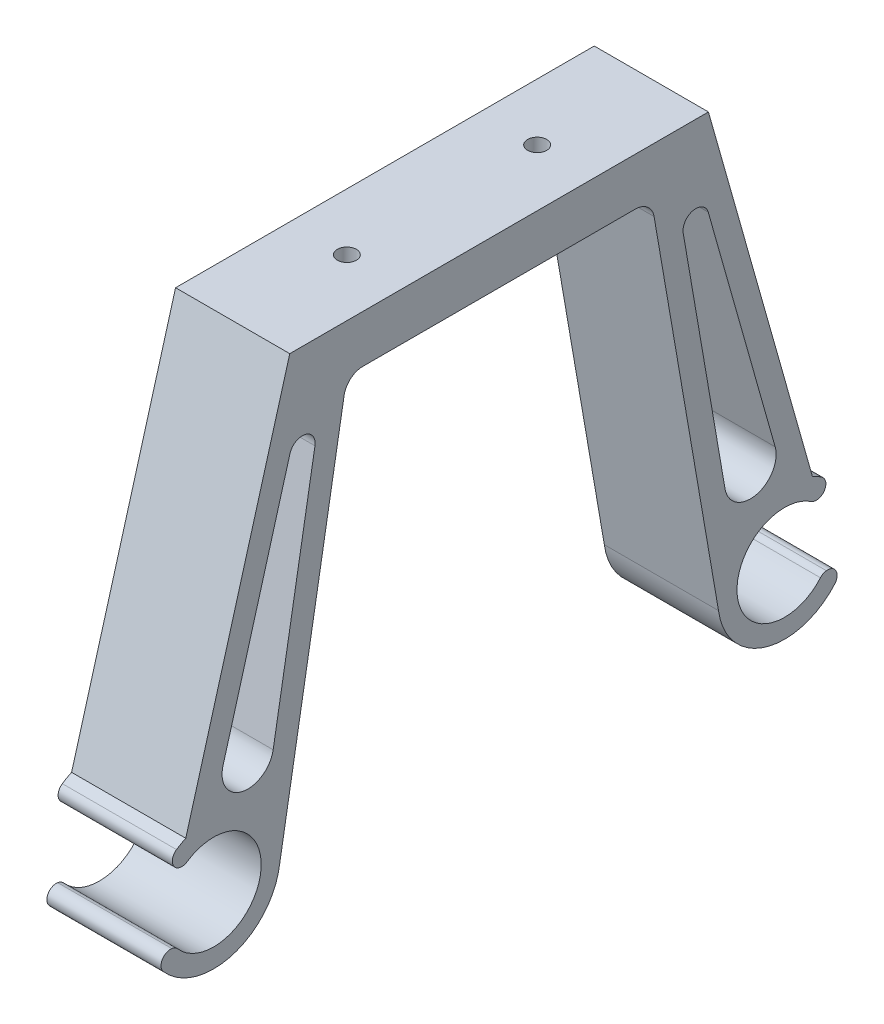
from build123d import *

# Parameters (mm, degrees)
SKETCH1_R           = 7
SKETCH1_R_2         = 5
BOSS_EXTRUDE1_DEPTH = 12
CUT_EXTRUDE1_DEPTH  = 40.522145691
FILLET1_R           = 1
BOSS_EXTRUDE2_START = -12
BOSS_EXTRUDE2_DEPTH = 12
FILLET2_R           = 2
CUT_EXTRUDE2_DEPTH  = 59.575636594
SKETCH7_R           = 1
CUT_EXTRUDE3_DEPTH  = 65.110102187


with BuildPart() as part:
    # Sketch1 → Boss-Extrude1 (new body)
    with BuildSketch(Plane(origin=(0, 0, 0), x_dir=(0, 0, -1), z_dir=(1, 0, 0))):
        with Locations((-30, 0)):
            Circle(SKETCH1_R)
        with Locations((-30, 0)):
            Circle(SKETCH1_R_2, mode=Mode.SUBTRACT)
    extrude(amount=BOSS_EXTRUDE1_DEPTH)

    # Sketch3 → Cut-Extrude1 (cut, through all)
    with BuildSketch(Plane(origin=(12, 0, 0), x_dir=(0, 0, -1), z_dir=(1, 0, 0))):
        Polygon((-26, 3), (-26.92060006, -3.93919992), (-40.375880399, -2.154133626), (-39.455280339, 4.785066294), align=None)
    extrude(amount=-CUT_EXTRUDE1_DEPTH, mode=Mode.SUBTRACT)

    # Fillet1
    fillet1_edges = [part.edges().sort_by_distance(p)[0] for p in [
        (6, 3.93919992, 33.07939994),
        (6, 4.266862999, 35.549223383),
        (6, -3, 34),
        (6, -2.672336921, 36.469823443),
    ]]
    fillet(fillet1_edges, radius=FILLET1_R - 0.0001)  # a hair under: the kernel refuses the full size

    # Sketch4 → Boss-Extrude2 (add)
    with BuildSketch(Plane(origin=(12, 0, 0), x_dir=(0, 0, -1), z_dir=(1, 0, 0)).offset(BOSS_EXTRUDE2_START)):
        with BuildLine():
            Line((-23.06080008, -0.92060006), (-16, 40))
            Line((-16, 40), (0, 40))
            Line((0, 40), (0, 45))
            Line((0, 45), (-22, 45))
            Line((-22, 45), (-32.927058907, 6.358641848))
            ThreePointArc((-32.927058907, 6.358641848), (-25.844141537, 5.632835914), (-23.06080008, -0.92060006))
        make_face()
    extrude(amount=BOSS_EXTRUDE2_DEPTH)

    # Fillet2
    fillet2_edges = [part.edges().sort_by_distance(p)[0] for p in [
        (6, 40, 16),
    ]]
    fillet(fillet2_edges, radius=FILLET2_R)

    # Sketch6 → Cut-Extrude2 (cut, through all)
    with BuildSketch(Plane(origin=(12, 0, 0), x_dir=(0, 0, -1), z_dir=(1, 0, 0))):
        with BuildLine():
            Line((-23.744298761, 9.820968741), (-19.349752742, 35.289394134))
            ThreePointArc((-19.349752742, 35.289394134), (-20.381234985, 36.835447129), (-21.979152767, 35.886292641))
            Line((-21.979152767, 35.886292641), (-29.011800399, 11.016740989))
            ThreePointArc((-29.011800399, 11.016740989), (-27.008090108, 7.643460534), (-23.744298761, 9.820968741))
        make_face()
    extrude(amount=-CUT_EXTRUDE2_DEPTH, mode=Mode.SUBTRACT)

    # Mirror9: part across plane


with BuildPart() as part_1:
    add(part.part)
    add(part.part.mirror(Plane(origin=(-56.505687485, 40, 0), x_dir=(1, 0, 0), z_dir=(0, 0, -1))))

    # Sketch7 → Cut-Extrude3 (cut, through all)
    with BuildSketch(Plane(origin=(0, 45, 0), x_dir=(1, 0, 0), z_dir=(0, 1, 0))):
        with Locations(Location((6, -10, 0), (0, 0, 270))):
            Circle(SKETCH7_R)
        with Locations(Location((6, 10, 0), (0, 0, 270))):
            Circle(SKETCH7_R)
    extrude(amount=-CUT_EXTRUDE3_DEPTH, mode=Mode.SUBTRACT)


solid = part_1.part
